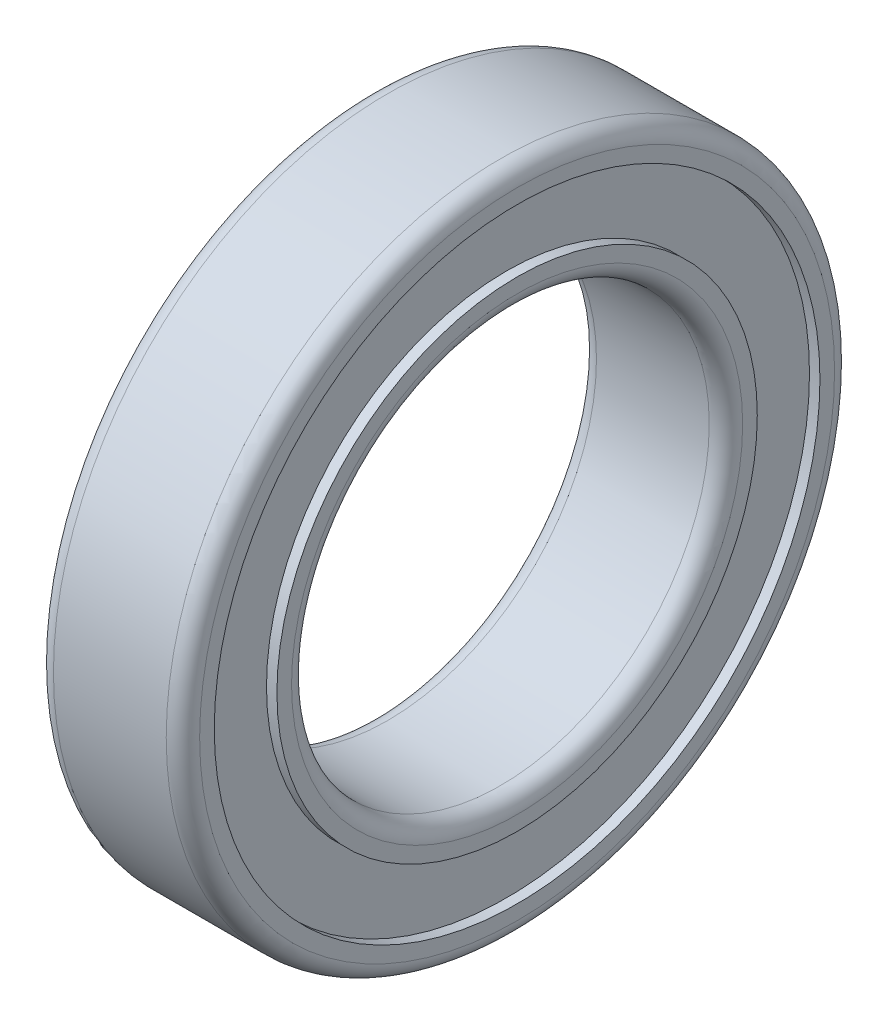
from build123d import *

# Parameters (mm, degrees)
FILLET_1_R = 0.8


with BuildPart() as part:
    # Эскиз1 → Повернуть1 (revolve)
    with BuildSketch(Plane.XY):
        Polygon((3.5, 10), (-3.5, 10), (-3.5, 11.5), (-3, 11.5), (-3, 14.5), (-3.5, 14.5), (-3.5, 16), (3.5, 16), (3.5, 14.5), (3, 14.5), (3, 11.5), (3.5, 11.5), align=None)
    revolve(axis=Axis((0, 0, 0), (-1, 0, 0)))

    # Скругление1
    fillet_1_edges = [part.edges().sort_by_distance(p)[0] for p in [
        (3.5, -16, 0),
        (-3.5, -16, 0),
        (-3.5, -10, 0),
        (3.5, -10, 0),
    ]]
    fillet(fillet_1_edges, radius=FILLET_1_R)


solid = part.part
